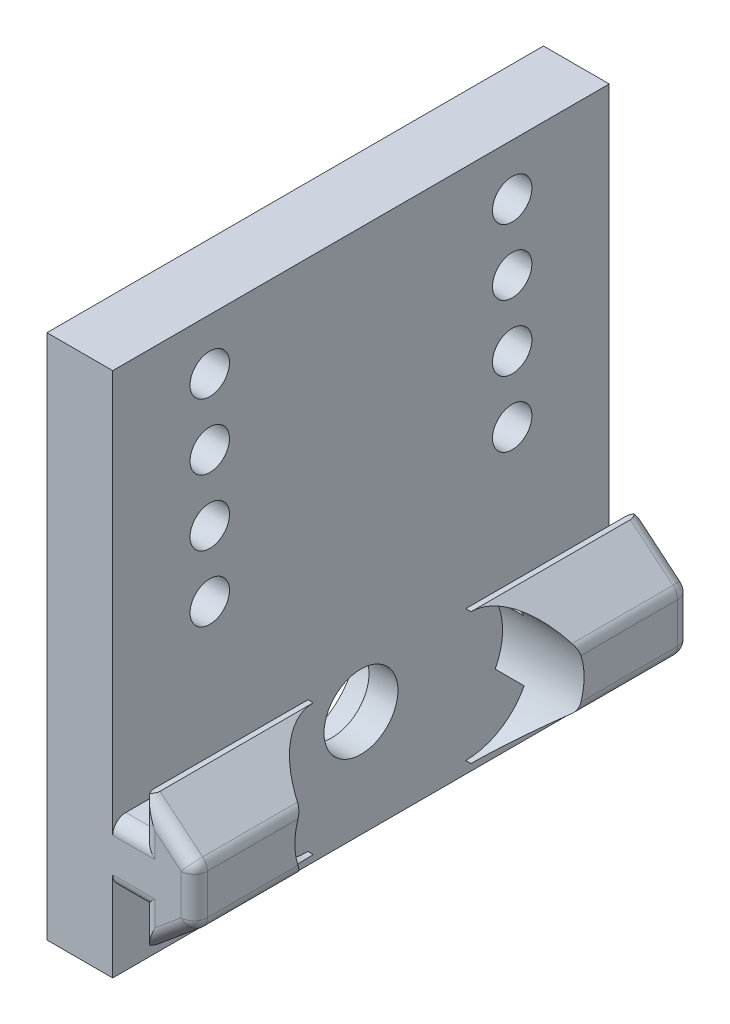
from build123d import *

# Parameters (mm, degrees)
BOSS_EXTRUDE1_DEPTH                              = 47.9552
SKETCH2_W                                        = 6.858
SKETCH2_H                                        = 3.429
CUT_EXTRUDE1_DEPTH                               = 50.010443612
SKETCH3_W                                        = 4.064
SKETCH3_H                                        = 47.9552
BOSS_EXTRUDE2_DEPTH                              = 7.366
SKETCH4_W                                        = 6.858
SKETCH4_H                                        = 3.429
CUT_EXTRUDE2_DEPTH                               = 50.674172887
SKETCH5_W                                        = 4.064
SKETCH5_H                                        = 47.9552
BOSS_EXTRUDE3_DEPTH                              = 7.366
FILLET1_R                                        = 1.27
FILLET3_R                                        = 1.27
FILLET5_R                                        = 1.27
SKETCH15_W                                       = 47.9552
SKETCH15_H                                       = 20.574
CUT_EXTRUDE3_DEPTH                               = 1.905
SKETCH17_W                                       = 47.9552
SKETCH17_H                                       = 30.226
BOSS_EXTRUDE4_DEPTH                              = 6.35
SKETCH20_W                                       = 47.9552
SKETCH20_H                                       = 20.574
BOSS_EXTRUDE6_DEPTH                              = 4.191
SKETCH21_R                                       = 1.905
CUT_EXTRUDE4_DEPTH                               = 50.321837791
CUT_EXTRUDE5_DEPTH                               = 48.878193189
CBORE_FOR_1_4_BUTTON_HEAD_CAP_SCREW1_D           = 7.14248
CBORE_FOR_1_4_BUTTON_HEAD_CAP_SCREW1_CBORE_D     = 11.90752
CBORE_FOR_1_4_BUTTON_HEAD_CAP_SCREW1_CBORE_DEPTH = 3.556


with BuildPart() as part:
    # Sketch1 → Boss-Extrude1 (new body)
    with BuildSketch(Plane.XY.offset(23.6855)):
        Polygon((3.302, 6.35), (-4.064, 6.35), (-4.064, -6.35), (3.302, -6.35), (7.874, -2.54), (7.874, 2.54), align=None)
    extrude(amount=-BOSS_EXTRUDE1_DEPTH)

    # Sketch2 → Cut-Extrude1 (cut, through all)
    with BuildSketch(Plane.XY.offset(23.6855)):
        with Locations((-0.635, 4.6355)):
            Rectangle(SKETCH2_W, SKETCH2_H)
    extrude(amount=-CUT_EXTRUDE1_DEPTH, mode=Mode.SUBTRACT)

    # Sketch3 → Boss-Extrude2 (add)
    with BuildSketch(Plane(origin=(0, 2.921, 0), x_dir=(-1, 0, 0), z_dir=(0, 1, 0))):
        with Locations((2.032, -0.2921)):
            Rectangle(SKETCH3_W, SKETCH3_H)
    extrude(amount=BOSS_EXTRUDE2_DEPTH)

    # Sketch4 → Cut-Extrude2 (cut, through all)
    with BuildSketch(Plane.XY.offset(23.6855)):
        with Locations((-0.635, -4.6355)):
            Rectangle(SKETCH4_W, SKETCH4_H)
    extrude(amount=-CUT_EXTRUDE2_DEPTH, mode=Mode.SUBTRACT)

    # Sketch5 → Boss-Extrude3 (add)
    with BuildSketch(Plane.XZ.offset(2.921)):
        with Locations((-2.032, -0.2921)):
            Rectangle(SKETCH5_W, SKETCH5_H)
    extrude(amount=BOSS_EXTRUDE3_DEPTH)

    # Fillet1
    fillet1_edges = [part.edges().sort_by_distance(p)[0] for p in [
        (7.874, 2.54, -0.2921),
        (7.874, -2.54, -0.2921),
    ]]
    fillet(fillet1_edges, radius=FILLET1_R)

    # Fillet3
    # the kernel refuses this fillet: 1.27 mm, written as the material it takes off along each edge
    with BuildSketch(Plane(origin=(0.862897437, -8.382585469, -24.2697), x_dir=(-0.6401843996644799, 0.7682212795973759, 0), z_dir=(0.7682212795973759, 0.6401843996644799, 0))) as fillet3_piece_1:
        with BuildLine():
            CenterArc((FILLET3_R, FILLET3_R), FILLET3_R, 180, 90)
            Line((0, FILLET3_R), (0, 0))
            Line((0, 0), (FILLET3_R, 0))
        make_face()
    extrude(amount=8.531574072, mode=Mode.SUBTRACT)
    with BuildSketch(Plane(origin=(6.604, -1.945163819, -24.2697), x_dir=(1, 0, 0), z_dir=(0, 1, 0))) as fillet3_piece_2:
        with BuildLine():
            CenterArc((1.27 - FILLET3_R, -FILLET3_R), FILLET3_R, 360, 90)
            Line((1.27, -FILLET3_R), (1.27, 0))
            Line((1.27, 0), (1.27 - FILLET3_R, 0))
        make_face()
    revolve(axis=Axis((6.604, -1.945163819, -24.2697), (0, 0, -1)), revolution_arc=50.194428908, mode=Mode.SUBTRACT)
    with BuildSketch(Plane(origin=(7.417034188, 2.920804844, -24.2697), x_dir=(0, 0, 1), z_dir=(-0.7682212795973759, 0.6401843996644799, 0))) as fillet3_piece_3:
        with BuildLine():
            CenterArc((FILLET3_R, -FILLET3_R), FILLET3_R, 90, 90)
            Line((0, -FILLET3_R), (0, 0))
            Line((0, 0), (FILLET3_R, 0))
        make_face()
    extrude(amount=8.531574072, mode=Mode.SUBTRACT)
    with BuildSketch(Plane(origin=(6.604, 1.945163819, -24.2697), x_dir=(0.6401843996644799, 0.7682212795973757, 0), z_dir=(-0.7682212795973757, 0.6401843996644799, 0))) as fillet3_piece_4:
        with BuildLine():
            CenterArc((1.27 - FILLET3_R, -FILLET3_R), FILLET3_R, 0, 90)
            Line((1.27 - FILLET3_R, 0), (1.27, 0))
            Line((1.27, 0), (1.27, -FILLET3_R))
        make_face()
    revolve(axis=Axis((6.604, 1.945163819, -24.2697), (0, 0, -1)), revolution_arc=50.194428908, mode=Mode.SUBTRACT)
    with BuildSketch(Plane(origin=(2.794, -2.921, -24.2697), x_dir=(0, 1, 0), z_dir=(-1, 0, 0)), Plane(origin=(0, 2.921, -24.2697), x_dir=(0, -1, 0), z_dir=(1, 0, 0))) as fillet3_piece_5:
        with BuildLine():
            CenterArc((FILLET3_R, -FILLET3_R), FILLET3_R, 90, 90)
            Line((0, -FILLET3_R), (0, 0))
            Line((0, 0), (FILLET3_R, 0))
        make_face()
    extrude(amount=2.794, mode=Mode.SUBTRACT)
    with BuildSketch(Plane(origin=(2.794, 2.921, -24.2697), x_dir=(1, 0, 0), z_dir=(0, 1, 0)), Plane(origin=(2.794, -9.525, -24.2697), x_dir=(1, 0, 0), z_dir=(0, 1, 0))) as fillet3_piece_6:
        with BuildLine():
            CenterArc((FILLET3_R, -FILLET3_R), FILLET3_R, 90, 90)
            Line((0, -FILLET3_R), (0, 0))
            Line((0, 0), (FILLET3_R, 0))
        make_face()
    extrude(amount=6.604, mode=Mode.SUBTRACT)
    with BuildSketch(Plane(origin=(7.874, -1.945163819, -24.2697), x_dir=(-1, 0, 0), z_dir=(0, 1, 0))) as fillet3_piece_7:
        with BuildLine():
            CenterArc((FILLET3_R, FILLET3_R), FILLET3_R, 180, 90)
            Line((0, FILLET3_R), (0, 0))
            Line((0, 0), (FILLET3_R, 0))
        make_face()
    extrude(amount=3.890327637, mode=Mode.SUBTRACT)
    with BuildSketch(Plane(origin=(2.794, -9.525, -24.2697), x_dir=(1, 0, 0), z_dir=(0, 1, 0))) as fillet3_piece_8a_section:
        with BuildLine():
            CenterArc((FILLET3_R, -FILLET3_R), FILLET3_R, 90, 90)
            Line((0, -FILLET3_R), (0, 0))
            Line((0, 0), (FILLET3_R, 0))
        make_face()
    fillet3_piece_8a = extrude(amount=9.779, mode=Mode.PRIVATE)
    fillet3_piece_8a = split(fillet3_piece_8a, bisect_by=Plane(origin=(3.081521795, -2.921, -23.982178205), z_dir=(0, 1, 0)), keep=Keep.TOP, mode=Mode.PRIVATE)
    with BuildSketch(Plane(origin=(5.969, -2.921, -24.2697), x_dir=(0, 1, 0), z_dir=(-1, 0, 0))) as fillet3_piece_8b_section:
        with BuildLine():
            CenterArc((FILLET3_R, -FILLET3_R), FILLET3_R, 90, 90)
            Line((0, -FILLET3_R), (0, 0))
            Line((0, 0), (FILLET3_R, 0))
        make_face()
    fillet3_piece_8b = extrude(amount=5.969, mode=Mode.PRIVATE)
    fillet3_piece_8b = split(fillet3_piece_8b, bisect_by=Plane(origin=(2.794, -2.633478205, -23.982178205), z_dir=(1, 0, 0)), keep=Keep.TOP, mode=Mode.PRIVATE)
    fillet3_piece_8 = fillet3_piece_8a & fillet3_piece_8b
    add(fillet3_piece_8, mode=Mode.SUBTRACT)
    with BuildSketch(Plane(origin=(2.794, -0.254, -24.2697), x_dir=(1, 0, 0), z_dir=(0, 1, 0))) as fillet3_piece_9a_section:
        with BuildLine():
            CenterArc((FILLET3_R, -FILLET3_R), FILLET3_R, 90, 90)
            Line((0, -FILLET3_R), (0, 0))
            Line((0, 0), (FILLET3_R, 0))
        make_face()
    fillet3_piece_9a = extrude(amount=9.779, mode=Mode.PRIVATE)
    fillet3_piece_9a = split(fillet3_piece_9a, bisect_by=Plane(origin=(3.081521795, 2.921, -23.982178205), z_dir=(0, -1, 0)), keep=Keep.TOP, mode=Mode.PRIVATE)
    with BuildSketch(Plane(origin=(0, 2.921, -24.2697), x_dir=(0, -1, 0), z_dir=(1, 0, 0))) as fillet3_piece_9b_section:
        with BuildLine():
            CenterArc((FILLET3_R, -FILLET3_R), FILLET3_R, 90, 90)
            Line((0, -FILLET3_R), (0, 0))
            Line((0, 0), (FILLET3_R, 0))
        make_face()
    fillet3_piece_9b = extrude(amount=5.969, mode=Mode.PRIVATE)
    fillet3_piece_9b = split(fillet3_piece_9b, bisect_by=Plane(origin=(2.794, 2.633478205, -23.982178205), z_dir=(1, 0, 0)), keep=Keep.TOP, mode=Mode.PRIVATE)
    fillet3_piece_9 = fillet3_piece_9a & fillet3_piece_9b
    add(fillet3_piece_9, mode=Mode.SUBTRACT)

    # Fillet5
    # the kernel refuses this fillet: 1.27 mm, written as the material it takes off along each edge
    with BuildSketch(Plane(origin=(0.862897437, -8.382585469, 23.6855), x_dir=(0, 0, -1), z_dir=(0.7682212795973759, 0.6401843996644799, 0)), Plane(origin=(7.417034188, 2.920804844, 23.6855), x_dir=(0, 0, -1), z_dir=(-0.7682212795973759, 0.6401843996644799, 0))) as fillet5_piece_1:
        with BuildLine():
            CenterArc((FILLET5_R, FILLET5_R), FILLET5_R, 180, 90)
            Line((0, FILLET5_R), (0, 0))
            Line((0, 0), (FILLET5_R, 0))
        make_face()
    extrude(amount=8.531574072, mode=Mode.SUBTRACT)
    with BuildSketch(Plane(origin=(6.604, -1.945163819, 23.6855), x_dir=(1, 0, 0), z_dir=(0, 1, 0))) as fillet5_piece_2:
        with BuildLine():
            CenterArc((1.27 - FILLET5_R, FILLET5_R), FILLET5_R, 270, 90)
            Line((1.27 - FILLET5_R, 0), (1.27, 0))
            Line((1.27, 0), (1.27, FILLET5_R))
        make_face()
    revolve(axis=Axis((6.604, -1.945163819, 23.6855), (0, 0, -1)), revolution_arc=50.194428908, mode=Mode.SUBTRACT)
    with BuildSketch(Plane(origin=(6.604, 1.945163819, 23.6855), x_dir=(0.6401843996644799, 0.7682212795973757, 0), z_dir=(-0.7682212795973757, 0.6401843996644799, 0))) as fillet5_piece_3:
        with BuildLine():
            CenterArc((1.27 - FILLET5_R, FILLET5_R), FILLET5_R, 270, 90)
            Line((1.27 - FILLET5_R, 0), (1.27, 0))
            Line((1.27, 0), (1.27, FILLET5_R))
        make_face()
    revolve(axis=Axis((6.604, 1.945163819, 23.6855), (0, 0, -1)), revolution_arc=50.194428908, mode=Mode.SUBTRACT)
    with BuildSketch(Plane(origin=(2.794, 2.921, 23.6855), x_dir=(0, 0, -1), z_dir=(0, 1, 0)), Plane(origin=(2.794, -9.525, 23.6855), x_dir=(0, 0, -1), z_dir=(0, 1, 0))) as fillet5_piece_4:
        with BuildLine():
            CenterArc((FILLET5_R, -FILLET5_R), FILLET5_R, 90, 90)
            Line((0, -FILLET5_R), (0, 0))
            Line((0, 0), (FILLET5_R, 0))
        make_face()
    extrude(amount=6.604, mode=Mode.SUBTRACT)
    with BuildSketch(Plane(origin=(0, 2.921, 23.6855), x_dir=(0, 0, -1), z_dir=(1, 0, 0)), Plane(origin=(2.794, -2.921, 23.6855), x_dir=(0, 0, -1), z_dir=(-1, 0, 0))) as fillet5_piece_5:
        with BuildLine():
            CenterArc((FILLET5_R, -FILLET5_R), FILLET5_R, 90, 90)
            Line((0, -FILLET5_R), (0, 0))
            Line((0, 0), (FILLET5_R, 0))
        make_face()
    extrude(amount=2.794, mode=Mode.SUBTRACT)
    with BuildSketch(Plane(origin=(7.874, -1.945163819, 23.6855), x_dir=(0, 0, -1), z_dir=(0, 1, 0))) as fillet5_piece_6:
        with BuildLine():
            CenterArc((FILLET5_R, FILLET5_R), FILLET5_R, 180, 90)
            Line((0, FILLET5_R), (0, 0))
            Line((0, 0), (FILLET5_R, 0))
        make_face()
    extrude(amount=3.890327637, mode=Mode.SUBTRACT)
    with BuildSketch(Plane(origin=(0, 2.921, 23.6855), x_dir=(0, 0, -1), z_dir=(1, 0, 0))) as fillet5_piece_7a_section:
        with BuildLine():
            CenterArc((FILLET5_R, -FILLET5_R), FILLET5_R, 90, 90)
            Line((0, -FILLET5_R), (0, 0))
            Line((0, 0), (FILLET5_R, 0))
        make_face()
    fillet5_piece_7a = extrude(amount=5.969, mode=Mode.PRIVATE)
    fillet5_piece_7a = split(fillet5_piece_7a, bisect_by=Plane(origin=(2.794, 2.633478205, 23.397978205), z_dir=(1, 0, 0)), keep=Keep.TOP, mode=Mode.PRIVATE)
    with BuildSketch(Plane(origin=(2.794, -0.254, 23.6855), x_dir=(0, 0, -1), z_dir=(0, 1, 0))) as fillet5_piece_7b_section:
        with BuildLine():
            CenterArc((FILLET5_R, -FILLET5_R), FILLET5_R, 90, 90)
            Line((0, -FILLET5_R), (0, 0))
            Line((0, 0), (FILLET5_R, 0))
        make_face()
    fillet5_piece_7b = extrude(amount=9.779, mode=Mode.PRIVATE)
    fillet5_piece_7b = split(fillet5_piece_7b, bisect_by=Plane(origin=(3.081521795, 2.921, 23.397978205), z_dir=(0, -1, 0)), keep=Keep.TOP, mode=Mode.PRIVATE)
    fillet5_piece_7 = fillet5_piece_7a & fillet5_piece_7b
    add(fillet5_piece_7, mode=Mode.SUBTRACT)
    with BuildSketch(Plane(origin=(2.794, -9.525, 23.6855), x_dir=(0, 0, -1), z_dir=(0, 1, 0))) as fillet5_piece_8a_section:
        with BuildLine():
            CenterArc((FILLET5_R, -FILLET5_R), FILLET5_R, 90, 90)
            Line((0, -FILLET5_R), (0, 0))
            Line((0, 0), (FILLET5_R, 0))
        make_face()
    fillet5_piece_8a = extrude(amount=9.779, mode=Mode.PRIVATE)
    fillet5_piece_8a = split(fillet5_piece_8a, bisect_by=Plane(origin=(3.081521795, -2.921, 23.397978205), z_dir=(0, 1, 0)), keep=Keep.TOP, mode=Mode.PRIVATE)
    with BuildSketch(Plane(origin=(5.969, -2.921, 23.6855), x_dir=(0, 0, -1), z_dir=(-1, 0, 0))) as fillet5_piece_8b_section:
        with BuildLine():
            CenterArc((FILLET5_R, -FILLET5_R), FILLET5_R, 90, 90)
            Line((0, -FILLET5_R), (0, 0))
            Line((0, 0), (FILLET5_R, 0))
        make_face()
    fillet5_piece_8b = extrude(amount=5.969, mode=Mode.PRIVATE)
    fillet5_piece_8b = split(fillet5_piece_8b, bisect_by=Plane(origin=(2.794, -2.633478205, 23.397978205), z_dir=(1, 0, 0)), keep=Keep.TOP, mode=Mode.PRIVATE)
    fillet5_piece_8 = fillet5_piece_8a & fillet5_piece_8b
    add(fillet5_piece_8, mode=Mode.SUBTRACT)

    # Sketch15 → Cut-Extrude3 (cut)
    with BuildSketch(Plane.ZY.offset(4.064)):
        with Locations((-0.2921, 0)):
            Rectangle(SKETCH15_W, SKETCH15_H)
    extrude(amount=-CUT_EXTRUDE3_DEPTH, mode=Mode.SUBTRACT)

    # Sketch17 → Boss-Extrude4 (add)
    with BuildSketch(Plane(origin=(0, 0, 0), x_dir=(0, 0, -1), z_dir=(1, 0, 0))):
        with Locations((0.2921, 25.4)):
            Rectangle(SKETCH17_W, SKETCH17_H)
    extrude(amount=-BOSS_EXTRUDE4_DEPTH)

    # Sketch20 → Boss-Extrude6 (add)
    with BuildSketch(Plane.ZY.offset(2.159)):
        with Locations((-0.2921, 0)):
            Rectangle(SKETCH20_W, SKETCH20_H)
    extrude(amount=BOSS_EXTRUDE6_DEPTH)

    # Sketch21 → Cut-Extrude4 (cut, through all)
    with BuildSketch(Plane.ZY.offset(6.35)):
        with Locations((-14.8971, 16.51)):
            Circle(SKETCH21_R)
        with Locations((14.3129, 16.51)):
            Circle(SKETCH21_R)
        with Locations((14.3129, 22.86)):
            Circle(SKETCH21_R)
        with Locations((14.3129, 29.21)):
            Circle(SKETCH21_R)
        with Locations((14.3129, 35.56)):
            Circle(SKETCH21_R)
        with Locations((-14.8971, 22.86)):
            Circle(SKETCH21_R)
        with Locations((-14.8971, 29.21)):
            Circle(SKETCH21_R)
        with Locations((-14.8971, 35.56)):
            Circle(SKETCH21_R)
    extrude(amount=-CUT_EXTRUDE4_DEPTH, mode=Mode.SUBTRACT)

    # Sketch22 → Cut-Extrude5 (cut, through all)
    with BuildSketch(Plane(origin=(0, 0, 0), x_dir=(0, 0, -1), z_dir=(1, 0, 0))):
        with BuildLine():
            Line((7.62, -6.35), (-7.62, -6.35))
            ThreePointArc((-7.62, -6.35), (-13.97, 0), (-7.62, 6.35))
            Line((-7.62, 6.35), (7.62, 6.35))
            ThreePointArc((7.62, 6.35), (13.97, 0), (7.62, -6.35))
        make_face()
    extrude(amount=CUT_EXTRUDE5_DEPTH, mode=Mode.SUBTRACT)

    # CBORE for 1/4 Button Head Cap Screw1 (through all)
    with Locations(Plane.ZY.offset(6.35)):
        with Locations((-0.2921, 0)):
            CounterBoreHole(CBORE_FOR_1_4_BUTTON_HEAD_CAP_SCREW1_D / 2, CBORE_FOR_1_4_BUTTON_HEAD_CAP_SCREW1_CBORE_D / 2, CBORE_FOR_1_4_BUTTON_HEAD_CAP_SCREW1_CBORE_DEPTH)


solid = part.part
